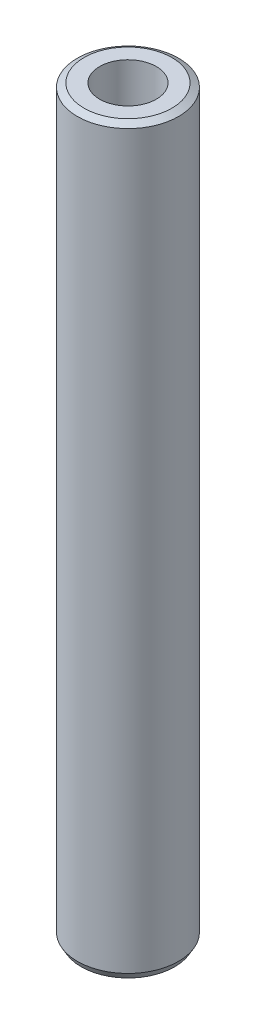
from build123d import *
from OCP.BRepFilletAPI import BRepFilletAPI_MakeChamfer

# Parameters (mm, degrees)
SKETCH1_R           = 27.5
BOSS_EXTRUDE1_DEPTH = 403.432877807
SKETCH2_R           = 15.408974312
CUT_EXTRUDE1_DEPTH  = 406.303080293
CHAMFER1_SIZE       = 2.091860848
CHAMFER1_SIZE2      = 3.623209271


with BuildPart() as part:
    # Sketch1 → Boss-Extrude1 (new body)
    with BuildSketch(Plane(origin=(0, 0, 0), x_dir=(1, 0, 0), z_dir=(0, 1, 0))):
        Circle(SKETCH1_R)
    extrude(amount=BOSS_EXTRUDE1_DEPTH)

    # Sketch2 → Cut-Extrude1 (cut, through all)
    with BuildSketch(Plane(origin=(0, 0, 0), x_dir=(1, 0, 0), z_dir=(0, 1, 0))):
        Circle(SKETCH2_R)
    extrude(amount=CUT_EXTRUDE1_DEPTH, mode=Mode.SUBTRACT)

    # Chamfer1: one chamfer whose edges measure the first distance from different faces: ONE call of the kernel's chamfer builder (chamfer() names one face for all edges)
    chamfer1_edges_1 = [part.edges().sort_by_distance(p)[0] for p in [
        (-27.5, 403.432877807, 0),
    ]]
    chamfer1_side_1 = [part.faces().sort_by_distance(p)[0] for p in [
        (-27.5, 201.716438903, 0),
    ]]
    chamfer1_edges_2 = [part.edges().sort_by_distance(p)[0] for p in [
        (-27.5, 0, 0),
    ]]
    chamfer1_side_2 = [part.faces().sort_by_distance(p)[0] for p in [
        (-26.722182541, 0, 0),
    ]]
    chamfer1 = BRepFilletAPI_MakeChamfer(part.part.solid().wrapped)
    for e in chamfer1_edges_1:
        chamfer1.Add(CHAMFER1_SIZE, CHAMFER1_SIZE2, e.wrapped, chamfer1_side_1[0].wrapped)  # the first distance lies on this face
    for e in chamfer1_edges_2:
        chamfer1.Add(CHAMFER1_SIZE, CHAMFER1_SIZE2, e.wrapped, chamfer1_side_2[0].wrapped)  # the first distance lies on this face
    add(Compound.cast(chamfer1.Shape()), mode=Mode.REPLACE)


solid = part.part
